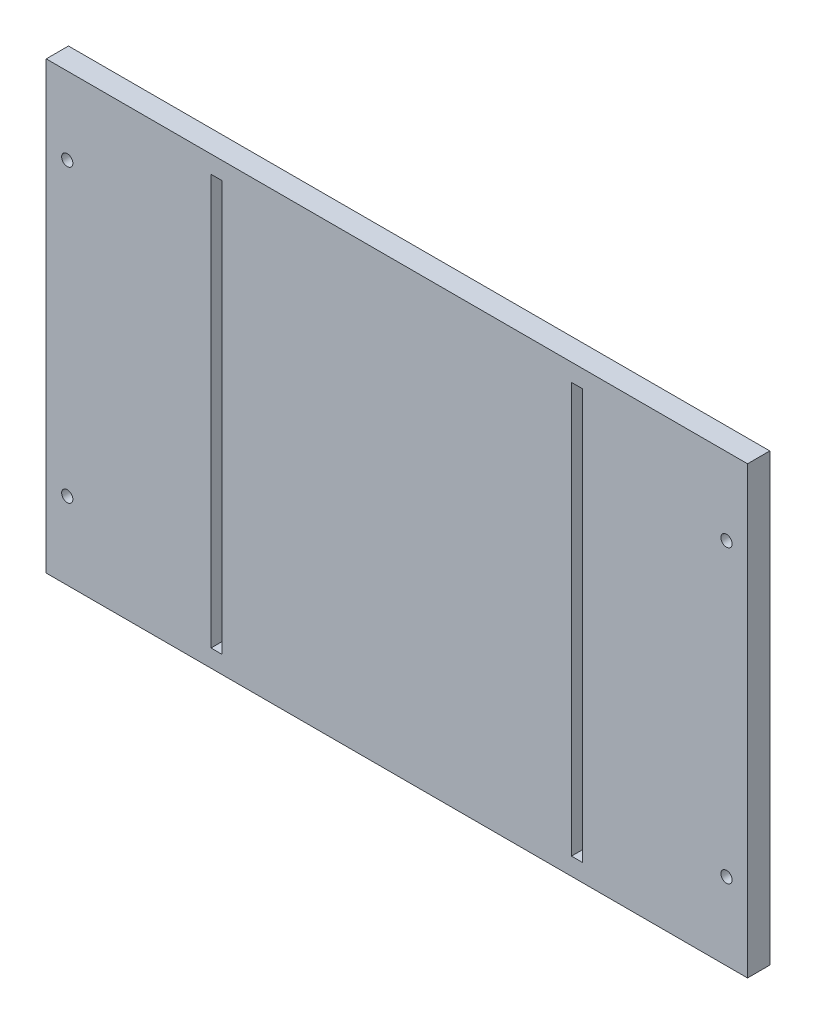
from build123d import *

# Parameters (mm, degrees)
SKETCH1_W          = 200
SKETCH1_H          = 127
SKETCH1_R          = 1.6
WALL_DEPTH         = 6.35
SKETCH6_W          = 3.2
SKETCH6_H          = 117
CUT_EXTRUDE1_DEPTH = 238.000680379


with BuildPart() as part:
    # Sketch1 → Wall (new body)
    with BuildSketch(Plane.XY):
        with Locations((100, 63.5)):
            Rectangle(SKETCH1_W, SKETCH1_H)
        with Locations((6, 105)):
            Circle(SKETCH1_R, mode=Mode.SUBTRACT)
        with Locations((194, 105)):
            Circle(SKETCH1_R, mode=Mode.SUBTRACT)
        with Locations((194, 22)):
            Circle(SKETCH1_R, mode=Mode.SUBTRACT)
        with Locations((6, 22)):
            Circle(SKETCH1_R, mode=Mode.SUBTRACT)
    extrude(amount=WALL_DEPTH)

    # Sketch6 → Cut-Extrude1 (cut, through all)
    with BuildSketch(Plane.XY.offset(6.35)):
        with Locations((48.6, 63.5)):
            Rectangle(SKETCH6_W, SKETCH6_H)
        with Locations((151.4, 63.5)):
            Rectangle(SKETCH6_W, SKETCH6_H)
    extrude(amount=-CUT_EXTRUDE1_DEPTH, mode=Mode.SUBTRACT)


solid = part.part
